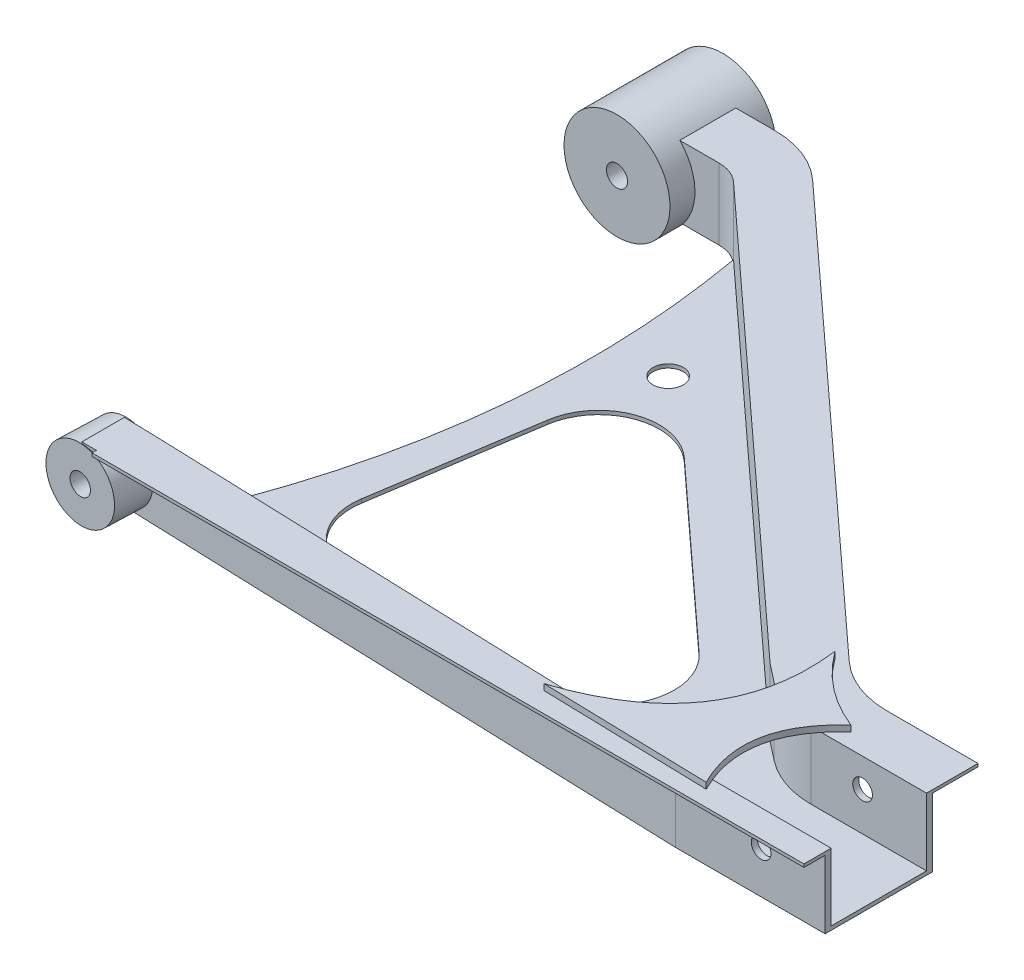
from build123d import *

# Parameters (mm, degrees)
SKETCH_2_R               = 10
EXTRUDE_2_DEPTH          = 2.5
EXTRUDE_3_DEPTH          = 47
EXTRUDE_4_DEPTH          = 47
CUT_EXTRUDE_2_DEPTH      = 45
EXTRUDE_5_DEPTH          = 4
EXTRUDE_6_DEPTH          = 49.5
EXTRUDE_6_DEPTH_BACK     = 20.5
SKETCH_5_R               = 35
EXTRUDE_8_DEPTH          = 24.5
EXTRUDE_8_DEPTH_BACK     = 5.5
SKETCH_6_3_R             = 23.5
SKETCH_6_3_R_2           = 7
CUT_EXTRUDE_4_DEPTH      = 35.5
CUT_EXTRUDE_4_DEPTH_BACK = 24.5
SKETCH_6_R               = 7
CUT_EXTRUDE_5_DEPTH      = 31
CUT_EXTRUDE_5_DEPTH_BACK = 118
CUT_EXTRUDE_7_DEPTH      = 10
SKETCH_13_R              = 23.5
SKETCH_13_R_2            = 7
EXTRUDE_9_DEPTH          = 5
SKETCH_14_R              = 7
CUT_EXTRUDE_8_DEPTH      = 326


with BuildPart() as part:
    # 草图2 → 凸台-拉伸2 (new body)
    with BuildSketch(Plane(origin=(0, 0, 0), x_dir=(1, 0, 0), z_dir=(0, 1, 0))):
        with BuildLine():
            add(Edge.make_bspline(
                [(66.535337275, 366.960093359), (97.433190899, 191.906412215), (25.491327677, 30.335008843)],
                knots=[0, 0, 0, 1, 1, 1], degree=2))
            Line((25.491327677, 30.335008843), (298.070406458, 20.879087079))
            Line((298.070406458, 20.879087079), (381.06378597, 18))
            Line((381.06378597, 18), (480.018834564, 18))
            Line((480.018834564, 18), (480.018834564, 81))
            Line((480.018834564, 81), (403.59654847, 81))
            ThreePointArc((403.59654847, 81), (384.052422459, 84.272342385), (366.640132179, 93.732428718))
            Line((366.640132179, 93.732428718), (354.182306501, 103.472649748))
            Line((354.182306501, 103.472649748), (66.535337275, 366.960093359))
        make_face()
        with Locations((63.069024618, 52.166207095)):
            Circle(SKETCH_2_R, mode=Mode.SUBTRACT)
        with BuildLine():
            Line((210.484938228, 194.417109435), (265.843761834, 143.707884329))
            Line((265.843761834, 143.707884329), (280.267263132, 130.495815747))
            ThreePointArc((280.267263132, 130.495815747), (290.530388989, 86.505736508), (253.248807869, 61.00000121))
            Line((253.248807869, 61.00000121), (167.295718615, 61.00000121))
            Line((167.295718615, 61.00000121), (119.992311174, 61.00000121))
            ThreePointArc((119.992311174, 61.00000121), (89.633225011, 74.955311015), (80.457661489, 107.083706844))
            Line((80.457661489, 107.083706844), (96.920664861, 214.067691653))
            ThreePointArc((96.920664861, 214.067691653), (123.181449566, 245.717320201), (163.47376981, 237.479800556))
            Line((163.47376981, 237.479800556), (210.484938228, 194.417109435))
        make_face(mode=Mode.SUBTRACT)
        with Locations((323.151772468, 73.823254893)):
            Circle(SKETCH_2_R, mode=Mode.SUBTRACT)
        with Locations((111.566817708, 278.73398761)):
            Circle(SKETCH_2_R, mode=Mode.SUBTRACT)
    extrude(amount=EXTRUDE_2_DEPTH)

    # 草图2<4> → 凸台-拉伸3 (add)
    with BuildSketch(Plane(origin=(0, 0, 0), x_dir=(1, 0, 0), z_dir=(0, 1, 0))):
        Polygon((0, 31.026794813), (0, 27.216911211), (380.994425705, 14), (480.018834564, 14), (480.018834564, 18), (381.06378597, 18), (298.070406458, 20.879087079), (25.491327677, 30.335008843), align=None)
        with BuildLine():
            ThreePointArc((50.999725499, 373), (59.333927702, 371.436909143), (66.535337275, 366.960093359))
            Line((66.535337275, 366.960093359), (354.182306501, 103.472649748))
            Line((354.182306501, 103.472649748), (366.640132179, 93.732428718))
            ThreePointArc((366.640132179, 93.732428718), (384.052422459, 84.272342385), (403.59654847, 81))
            Line((403.59654847, 81), (480.018834564, 81))
            Line((480.018834564, 81), (480.018834564, 85))
            Line((480.018834564, 85), (403.59654847, 85))
            ThreePointArc((403.59654847, 85), (385.355364193, 88.054186226), (369.103893265, 96.883600137))
            Line((369.103893265, 96.883600137), (356.892394312, 106.431229232))
            Line((356.892394312, 106.431229232), (356.884152027, 106.422231202))
            Line((356.884152027, 106.422231202), (356.769043373, 106.527671857))
            Line((356.769043373, 106.527671857), (68.090449936, 370.960093359))
            ThreePointArc((68.090449936, 370.960093359), (60.889040363, 375.436909143), (52.554838159, 377))
            Line((52.554838159, 377), (0, 377))
            Line((0, 377), (0, 373))
            Line((0, 373), (50.999725499, 373))
        make_face()
    extrude(amount=EXTRUDE_3_DEPTH)

    # 草图2<6> → 凸台-拉伸4 (add)
    with BuildSketch(Plane(origin=(0, 0, 0), x_dir=(1, 0, 0), z_dir=(0, 1, 0))):
        Polygon((0, 0), (480.018834564, 0), (480.018834564, 13.998527319), (480.018834564, 18), (381.06378597, 18), (298.070406458, 20.879087079), (25.491327677, 30.335008843), (0, 31.026794813), align=None)
        with BuildLine():
            Line((403.59654847, 85), (480.018834564, 85))
            Line((480.018834564, 85), (480.018834564, 115))
            Line((480.018834564, 115), (419.702060514, 115))
            ThreePointArc((419.702060514, 115), (397.96066346, 119.077628321), (379.174377619, 130.756278195))
            Line((379.174377619, 130.756278195), (91.527408393, 394.243721805))
            ThreePointArc((91.527408393, 394.243721805), (72.741122552, 405.922371679), (50.999725499, 410))
            Line((50.999725499, 410), (0, 410))
            Line((0, 410), (0, 377))
            Line((0, 377), (52.554838159, 377))
            ThreePointArc((52.554838159, 377), (60.889040363, 375.436909143), (68.090449936, 370.960093359))
            Line((68.090449936, 370.960093359), (356.769043373, 106.527671857))
            Line((356.769043373, 106.527671857), (369.103893265, 96.883600137))
            ThreePointArc((369.103893265, 96.883600137), (385.355364193, 88.054186226), (403.59654847, 85))
        make_face()
    extrude(amount=EXTRUDE_4_DEPTH)

    # 草图2<8> → 切除-拉伸2 (cut)
    with BuildSketch(Plane(origin=(0, 0, 0), x_dir=(1, 0, 0), z_dir=(0, 1, 0))):
        Polygon((0, 27.216911211), (0, 0), (480.018834564, 0), (480.018834564, 13.998527319), (480.018834564, 14), (380.994425705, 14), align=None)
        with BuildLine():
            Line((403.59654847, 85), (480.018834564, 85))
            Line((480.018834564, 85), (480.018834564, 115))
            Line((480.018834564, 115), (419.702060514, 115))
            ThreePointArc((419.702060514, 115), (397.96066346, 119.077628321), (379.174377619, 130.756278195))
            Line((379.174377619, 130.756278195), (91.527408393, 394.243721805))
            ThreePointArc((91.527408393, 394.243721805), (72.741122552, 405.922371679), (50.999725499, 410))
            Line((50.999725499, 410), (0, 410))
            Line((0, 410), (0, 377))
            Line((0, 377), (52.554838159, 377))
            ThreePointArc((52.554838159, 377), (60.889040363, 375.436909143), (68.090449936, 370.960093359))
            Line((68.090449936, 370.960093359), (356.769043373, 106.527671857))
            Line((356.769043373, 106.527671857), (369.103893265, 96.883600137))
            ThreePointArc((369.103893265, 96.883600137), (385.355364193, 88.054186226), (403.59654847, 85))
        make_face()
    extrude(amount=CUT_EXTRUDE_2_DEPTH, mode=Mode.SUBTRACT)

    # 草图3 → 凸台-拉伸5 (add)
    with BuildSketch(Plane(origin=(0, 47, 0), x_dir=(1, 0, 0), z_dir=(0, 1, 0))):
        with BuildLine():
            Line((295.056115028, 13.302883956), (405.018705009, 10.434294652))
            add(Edge.make_bspline(
                [(405.018705009, 10.434294652), (381.920482995, 56.306840436), (420, 91)],
                knots=[0.140921029, 0.140921029, 0.140921029, 1.140921029, 1.140921029, 1.140921029], degree=2))
            add(Edge.make_bspline(
                [(420, 91), (390.907181835, 102.66550813), (372.580466903, 128.060677104)],
                knots=[0, 0, 0, 1, 1, 1], degree=2))
            add(Edge.make_bspline(
                [(372.580466903, 128.060677104), (383.545524604, 42.338798312), (295.056115028, 13.302883956)],
                knots=[0, 0, 0, 1, 1, 1], degree=2))
        make_face()
    extrude(amount=EXTRUDE_5_DEPTH)

    # 草图5 → 凸台-拉伸6 (add, two sides: drawn at the far end of the back side and taken through both)
    with BuildSketch(Plane(origin=(0, 0, -377), x_dir=(-1, 0, 0), z_dir=(0, 0, -1)).offset(-EXTRUDE_6_DEPTH_BACK)):
        with Locations((0, 22.5)):
            Circle(SKETCH_5_R)
        with BuildLine():
            ThreePointArc((7, 22.5), (4.949747468, 17.550252532), (0, 15.5))
            ThreePointArc((0, 15.5), (-7, 22.5), (0, 29.5))
            ThreePointArc((0, 29.5), (4.949747468, 27.449747468), (7, 22.5))
        make_face(mode=Mode.SUBTRACT)
    extrude(amount=EXTRUDE_6_DEPTH + EXTRUDE_6_DEPTH_BACK)

    # 草图6<3> → 凸台-拉伸8 (add, two sides: drawn at the far end of the back side and taken through both)
    with BuildSketch(Plane(origin=(0.943035097, 0, -27.184196792), x_dir=(0.9993988249637922, 0, 0.03466970811806164), z_dir=(-0.03466970811806164, 0, 0.9993988249637923)).offset(-EXTRUDE_8_DEPTH_BACK)):
        with Locations((-0.943602368, 22.5)):
            Circle(SKETCH_6_3_R)
        with Locations((-0.943602368, 22.5)):
            Circle(SKETCH_6_3_R_2, mode=Mode.SUBTRACT)
    extrude(amount=EXTRUDE_8_DEPTH + EXTRUDE_8_DEPTH_BACK)

    # 草图6 → 切除-拉伸4 (cut, two sides: drawn at the far end of the back side and taken through both)
    with BuildSketch(Plane(origin=(0.943035097, 0, -27.184196792), x_dir=(0.9993988249637922, 0, 0.03466970811806164), z_dir=(-0.03466970811806164, 0, 0.9993988249637923)).offset(-CUT_EXTRUDE_4_DEPTH_BACK)):
        with Locations((-0.943602368, 22.5)):
            Circle(SKETCH_6_R)
    extrude(amount=CUT_EXTRUDE_4_DEPTH + CUT_EXTRUDE_4_DEPTH_BACK, mode=Mode.SUBTRACT)

    # 草图10 → 切除-拉伸5 (cut, two sides: drawn at the far end of the back side and taken through both)
    with BuildSketch(Plane(origin=(0, 0, -85), x_dir=(-1, 0, 0), z_dir=(0, 0, -1)).offset(-CUT_EXTRUDE_5_DEPTH_BACK)):
        with BuildLine():
            ThreePointArc((-437.748834564, 21.5), (-433.152640486, 23.403805922), (-431.248834564, 28))
            ThreePointArc((-431.248834564, 28), (-442.345028641, 32.596194078), (-437.748834564, 21.5))
        make_face()
    extrude(amount=CUT_EXTRUDE_5_DEPTH + CUT_EXTRUDE_5_DEPTH_BACK, mode=Mode.SUBTRACT)

    # 草图12 → 切除-拉伸7 (cut)
    with BuildSketch(Plane(origin=(0, 47, 0), x_dir=(1, 0, 0), z_dir=(0, 1, 0))):
        Polygon((0, 0), (9.608777796, 0), (9.608777796, 2.511490201), (9.608777796, 2.911490201), (5, 2.911490201), (0, 2.911490201), (0, 2.3), align=None)
    extrude(amount=-CUT_EXTRUDE_7_DEPTH, mode=Mode.SUBTRACT)

    # 草图13 → 凸台-拉伸9 (add)
    with BuildSketch(Plane(origin=(0.093627248, 0, -2.698925581), x_dir=(0.9993988249637922, 0, 0.03466970811806163), z_dir=(-0.03466970811806163, 0, 0.9993988249637923))):
        with Locations((-0.943602368, 22.5)):
            Circle(SKETCH_13_R)
        with Locations((-0.943602368, 22.5)):
            Circle(SKETCH_13_R_2, mode=Mode.SUBTRACT)
    extrude(amount=-EXTRUDE_9_DEPTH)

    # 草图14 → 切除-拉伸8 (cut)
    with BuildSketch(Plane(origin=(0, 0, -426.5), x_dir=(-1, 0, 0), z_dir=(0, 0, -1))):
        with Locations((0, 22.5)):
            Circle(SKETCH_14_R)
    extrude(amount=-CUT_EXTRUDE_8_DEPTH, mode=Mode.SUBTRACT)


solid = part.part
